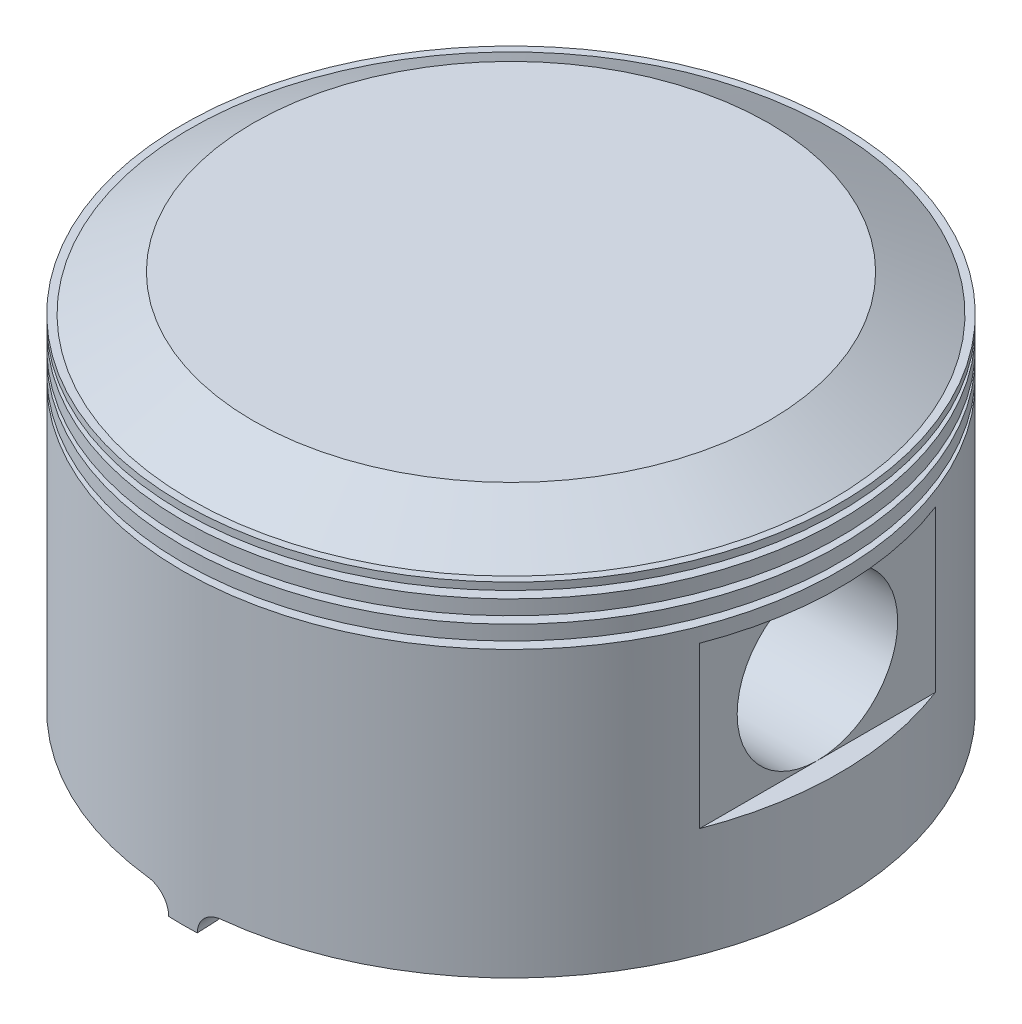
from build123d import *

# Parameters (mm, degrees)
BOSS_EXTRUDE1_REACH     = 84.183
CUT_EXTRUDE1_DEPTH      = 91.676766104
CUT_EXTRUDE1_DEPTH_BACK = 91.676766104
GUDGEON_HOLE_R          = 11
CUT_EXTRUDE2_DEPTH      = 114.265175749
RING_CS_W               = 2
RING_CS_H               = 1
BOSS_EXTRUDE2_DEPTH     = 3
FILLET1_R               = 3


with BuildPart() as part:
    # Piston CS → Revolve1 (revolve)
    with BuildSketch(Plane.XY, mode=Mode.PRIVATE) as revolve1_sk:
        Polygon((0, 0), (0, -5), (2.220419784, -5), (37, -25.08), (37, -35.08), (42, -35.08), (42, -52), (45, -52), (45, -5), (44, -5), (35.339745962, 0), align=None)
    revolve(revolve1_sk.sketch.rotate(Axis((0, 0, 0), (0, -1, 0)), 90), axis=Axis((0, 0, 0), (0, -1, 0)))

    # Sketch5 → Boss-Extrude1 (add, up to next)
    with BuildSketch(Plane.XZ.offset(52), mode=Mode.PRIVATE) as boss_extrude1_sk1:
        with BuildLine():
            Line((-24.103941586, -38), (-24.103941586, -15))
            Line((-24.103941586, -15), (-14.103941586, -15))
            Line((-14.103941586, -15), (-14.103941586, 15))
            Line((-14.103941586, 15), (-24.103941586, 15))
            Line((-24.103941586, 15), (-24.103941586, 38))
            ThreePointArc((-24.103941586, 38), (-45, 0), (-24.103941586, -38))
        make_face()
    boss_extrude1_tool1 = extrude(boss_extrude1_sk1.sketch, amount=-BOSS_EXTRUDE1_REACH, mode=Mode.PRIVATE) - part.part
    # Sketch5 → Boss-Extrude1 (add, up to next)
    with BuildSketch(Plane.XZ.offset(52), mode=Mode.PRIVATE) as boss_extrude1_sk2:
        with BuildLine():
            Line((24.103941586, 38), (24.103941586, 15))
            Line((24.103941586, 15), (14.103941586, 15))
            Line((14.103941586, 15), (14.103941586, -15))
            Line((14.103941586, -15), (24.103941586, -15))
            Line((24.103941586, -15), (24.103941586, -38))
            ThreePointArc((24.103941586, -38), (45, 0), (24.103941586, 38))
        make_face()
    boss_extrude1_tool2 = extrude(boss_extrude1_sk2.sketch, amount=-BOSS_EXTRUDE1_REACH, mode=Mode.PRIVATE) - part.part
    add(boss_extrude1_tool1.solids().sort_by_distance((-29.792455, -52, 0))[0])
    add(boss_extrude1_tool2.solids().sort_by_distance((29.792455, -52, 0))[0])

    # Gudgeon Hole → Cut-Extrude1 (cut, two sides: drawn at the far end of the back side and taken through both)
    with BuildSketch(Plane(origin=(-14.103941586, 0, 0), x_dir=(0, 0, -1), z_dir=(1, 0, 0)).offset(-CUT_EXTRUDE1_DEPTH_BACK)):
        with Locations((0, -26)):
            Circle(GUDGEON_HOLE_R)
    extrude(amount=CUT_EXTRUDE1_DEPTH + CUT_EXTRUDE1_DEPTH_BACK, mode=Mode.SUBTRACT)

    # Gudgeon Hole Cutouts → Cut-Extrude2 (cut, through all)
    with BuildSketch(Plane.XY.offset(45)):
        with BuildLine():
            Line((-42, -15), (-45, -15))
            add(Edge.make_bspline(
                [(-45, -15), (-42.311111111, -26), (-45, -37)],
                knots=[0, 0, 0, 1, 1, 1], degree=2, weights=[0.034, 0.045, 0.056]))
            Line((-45, -37), (-42, -37))
            Line((-42, -37), (-42, -15))
        make_face()
        with BuildLine():
            Line((42, -37), (45, -37))
            add(Edge.make_bspline(
                [(45, -37), (42.311111111, -26), (45, -15)],
                knots=[0, 0, 0, 1, 1, 1], degree=2, weights=[0.034, 0.045, 0.056]))
            Line((45, -15), (42, -15))
            Line((42, -15), (42, -37))
        make_face()
    extrude(amount=-CUT_EXTRUDE2_DEPTH, mode=Mode.SUBTRACT)

    # Ring CS → Cut-Revolve1 (revolve, cut)
    with BuildSketch(Plane.XY, mode=Mode.PRIVATE) as cut_revolve1_sk:
        with Locations((44, -6.5)):
            Rectangle(RING_CS_W, RING_CS_H)
        with Locations((44, -9.5)):
            Rectangle(RING_CS_W, RING_CS_H)
        with Locations((44, -12.5)):
            Rectangle(RING_CS_W, RING_CS_H)
    revolve(cut_revolve1_sk.sketch.rotate(Axis((0, 0, 0), (0, -1, 0)), 90), axis=Axis((0, 0, 0), (0, -1, 0)), mode=Mode.SUBTRACT)

    # Sketch9 → Boss-Extrude2 (add)
    with BuildSketch(Plane.XZ.offset(52)):
        with BuildLine():
            Line((-1.832014269, 41.960025306), (-1.962872431, 44.957169971))
            ThreePointArc((-1.962872431, 44.957169971), (0, 45), (1.962872431, 44.957169971))
            Line((1.962872431, 44.957169971), (1.832014269, 41.960025306))
            ThreePointArc((1.832014269, 41.960025306), (0, 42), (-1.832014269, 41.960025306))
        make_face()
        with BuildLine():
            Line((1.832014269, -41.960025306), (1.962872431, -44.957169971))
            ThreePointArc((1.962872431, -44.957169971), (0, -45), (-1.962872431, -44.957169971))
            Line((-1.962872431, -44.957169971), (-1.832014269, -41.960025306))
            ThreePointArc((-1.832014269, -41.960025306), (0, -42), (1.832014269, -41.960025306))
        make_face()
    extrude(amount=BOSS_EXTRUDE2_DEPTH)

    # Fillet1
    # the kernel refuses this fillet: 3 mm, written as the material it adds along each edge
    with BuildSketch(Plane(origin=(-1.504868864, -52, 34.467163645), x_dir=(-0.999048221581858, 0, -0.043619387365329124), z_dir=(-0.043619387365329124, 0, 0.9990482215818581))) as fillet1_piece_1_section:
        with BuildLine():
            CenterArc((FILLET1_R, FILLET1_R), FILLET1_R, 180, 90)
            Line((0, FILLET1_R), (0, 0))
            Line((0, 0), (FILLET1_R, 0))
        make_face()
    fillet1_piece_1 = extrude(amount=18, mode=Mode.PRIVATE)
    fillet1_piece_1 = fillet1_piece_1 & Plane(origin=(0, -52.679071729, 0), x_dir=(0, 0, 1), z_dir=(0, 1, 0)) * Cylinder(45, 49, mode=Mode.PRIVATE)
    fillet1_piece_1 = fillet1_piece_1 - Plane(origin=(0, -52.679071729, 0), x_dir=(0, 0, 1), z_dir=(0, -1, 0)) * Cylinder(42, 49, mode=Mode.PRIVATE)
    add(fillet1_piece_1)
    with BuildSketch(Plane(origin=(2.290017837, -52, 52.450031633), x_dir=(0.9990482215818575, 0, -0.04361938736534308), z_dir=(-0.04361938736534308, 0, -0.9990482215818575))) as fillet1_piece_2_section:
        with BuildLine():
            CenterArc((FILLET1_R, FILLET1_R), FILLET1_R, 180, 90)
            Line((0, FILLET1_R), (0, 0))
            Line((0, 0), (FILLET1_R, 0))
        make_face()
    fillet1_piece_2 = extrude(amount=18, mode=Mode.PRIVATE)
    fillet1_piece_2 = fillet1_piece_2 - Plane(origin=(0, -52.679065019, 0), x_dir=(0, 0, 1), z_dir=(0, -1, 0)) * Cylinder(42, 49, mode=Mode.PRIVATE)
    fillet1_piece_2 = fillet1_piece_2 & Plane(origin=(0, -52.679065019, 0), x_dir=(0, 0, 1), z_dir=(0, 1, 0)) * Cylinder(45, 49, mode=Mode.PRIVATE)
    add(fillet1_piece_2)
    with BuildSketch(Plane(origin=(1.504868864, -52, -34.467163645), x_dir=(0.9990482215818575, 0, 0.04361938736534308), z_dir=(0.04361938736534308, 0, -0.9990482215818575))) as fillet1_piece_3_section:
        with BuildLine():
            CenterArc((FILLET1_R, FILLET1_R), FILLET1_R, 180, 90)
            Line((0, FILLET1_R), (0, 0))
            Line((0, 0), (FILLET1_R, 0))
        make_face()
    fillet1_piece_3 = extrude(amount=18, mode=Mode.PRIVATE)
    fillet1_piece_3 = fillet1_piece_3 - Plane(origin=(0, -52.679069886, 0), x_dir=(0, 0, 1), z_dir=(0, -1, 0)) * Cylinder(42, 49, mode=Mode.PRIVATE)
    fillet1_piece_3 = fillet1_piece_3 & Plane(origin=(0, -52.679069886, 0), x_dir=(0, 0, 1), z_dir=(0, 1, 0)) * Cylinder(45, 49, mode=Mode.PRIVATE)
    add(fillet1_piece_3)
    with BuildSketch(Plane(origin=(-2.290017837, -52, -52.450031633), x_dir=(-0.999048221581858, 0, 0.04361938736532913), z_dir=(0.043619387365329124, 0, 0.9990482215818581))) as fillet1_piece_4_section:
        with BuildLine():
            CenterArc((FILLET1_R, FILLET1_R), FILLET1_R, 180, 90)
            Line((0, FILLET1_R), (0, 0))
            Line((0, 0), (FILLET1_R, 0))
        make_face()
    fillet1_piece_4 = extrude(amount=18, mode=Mode.PRIVATE)
    fillet1_piece_4 = fillet1_piece_4 - Plane(origin=(0, -52.679069383, 0), x_dir=(0, 0, 1), z_dir=(0, -1, 0)) * Cylinder(42, 49, mode=Mode.PRIVATE)
    fillet1_piece_4 = fillet1_piece_4 & Plane(origin=(0, -52.679069383, 0), x_dir=(0, 0, 1), z_dir=(0, 1, 0)) * Cylinder(45, 49, mode=Mode.PRIVATE)
    add(fillet1_piece_4)


solid = part.part
